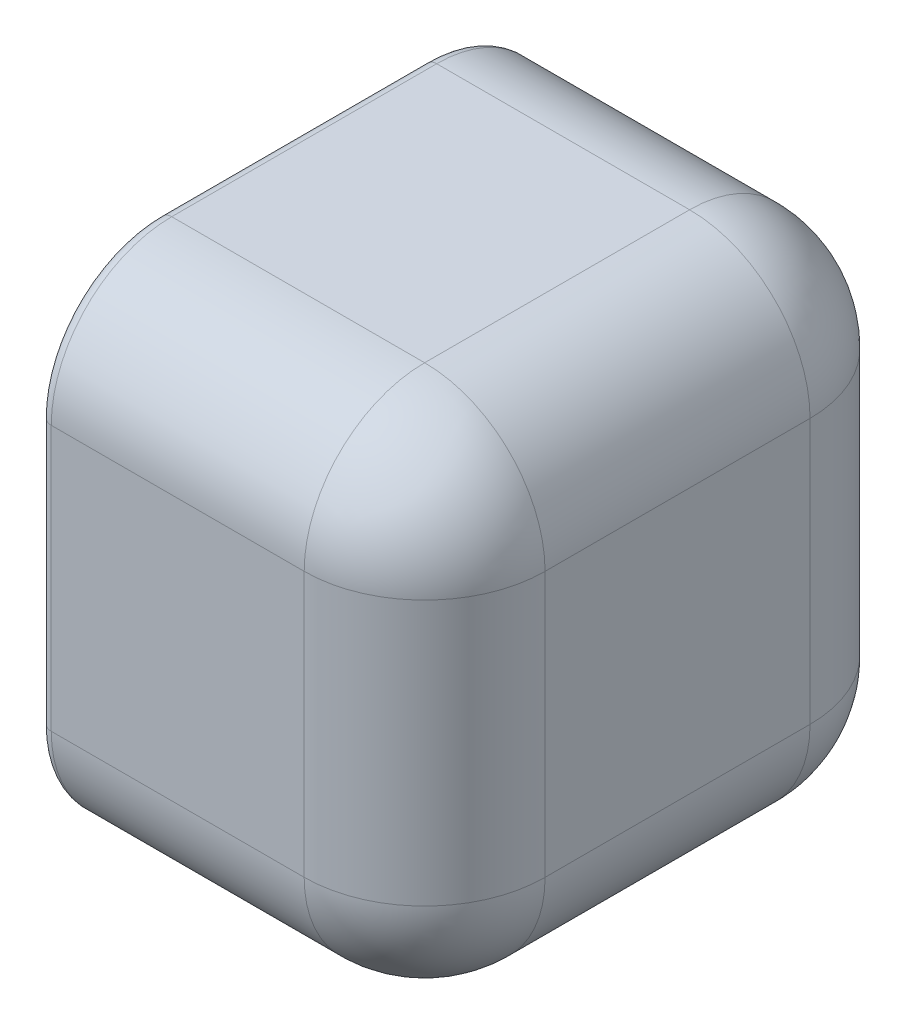
from build123d import *

# Parameters (mm, degrees)
ESQUISSE1_W             = 42
ESQUISSE1_H             = 42
BOSS_EXTRU_1_DEPTH      = 42
CONG_1_R                = 10
ESQUISSE10_W            = 10.140474199
ESQUISSE10_H            = 42
ENL_V_MAT_EXTRU_1_DEPTH = 64
ESQUISSE2_W             = 3.1
ESQUISSE2_H             = 14
ENL_V_MAT_EXTRU_5_DEPTH = 8
ESQUISSE14_W            = 30.142135624
ESQUISSE14_H            = 30.142135624
ENL_V_MAT_EXTRU_6_DEPTH = 22
ESQUISSE21_W            = 7
ESQUISSE21_H            = 7
BOSS_EXTRU_2_DEPTH      = 20
ESQUISSE24_R            = 1.675
ENL_V_MAT_EXTRU_8_DEPTH = 26
CONG_2_R                = 1
ESQUISSE27_R            = 2.375
ENL_V_MAT_EXTRU_9_DEPTH = 10


with BuildPart() as part:
    # Esquisse1 → Boss.-Extru.1 (new body)
    with BuildSketch(Plane.XY):
        Rectangle(ESQUISSE1_W, ESQUISSE1_H)
    extrude(amount=BOSS_EXTRU_1_DEPTH)

    # Congé1
    cong_1_edges = [part.edges().sort_by_distance(p)[0] for p in [
        (-21, 0, 42),
        (0, -21, 42),
        (21, 0, 42),
        (0, -21, 0),
        (-21, 0, 0),
        (0, 21, 0),
        (21, 0, 0),
        (21, -21, 21),
        (-21, -21, 21),
        (-21, 21, 21),
        (21, 21, 21),
        (0, 21, 42),
    ]]
    fillet(cong_1_edges, radius=CONG_1_R)

    # Esquisse10 → Enlèv. mat.-Extru.1 (cut, through all)
    with BuildSketch(Plane(origin=(0, -21, 0), x_dir=(-1, 0, 0), z_dir=(0, -1, 0))):
        with Locations((16.070237099, -21)):
            Rectangle(ESQUISSE10_W, ESQUISSE10_H)
    extrude(amount=-ENL_V_MAT_EXTRU_1_DEPTH, mode=Mode.SUBTRACT)

    # Esquisse2 → Enlèv. mat.-Extru.5 (cut)
    with BuildSketch(Plane(origin=(0, 0, 0), x_dir=(-1, 0, 0), z_dir=(0, 0, -1))):
        Rectangle(ESQUISSE2_W, ESQUISSE2_H)
    extrude(amount=-ENL_V_MAT_EXTRU_5_DEPTH, mode=Mode.SUBTRACT)

    # Esquisse14 → Enlèv. mat.-Extru.6 (cut)
    with BuildSketch(Plane.ZY.offset(11)):
        with Locations((21, 0)):
            Rectangle(ESQUISSE14_W, ESQUISSE14_H)
    extrude(amount=-ENL_V_MAT_EXTRU_6_DEPTH, mode=Mode.SUBTRACT)

    # Esquisse21 → Boss.-Extru.2 (add)
    with BuildSketch(Plane.ZY.offset(-11)):
        with Locations((32.571067812, -11.571067812)):
            Rectangle(ESQUISSE21_W, ESQUISSE21_H)
        with Locations((32.571067812, 11.571067812)):
            Rectangle(ESQUISSE21_W, ESQUISSE21_H)
    extrude(amount=BOSS_EXTRU_2_DEPTH)

    # Esquisse24 → Enlèv. mat.-Extru.8 (cut)
    with BuildSketch(Plane.ZY.offset(-11)):
        with Locations(Location((32.071067812, 11.571067812, 0), (0, 0, 180))):
            Circle(ESQUISSE24_R)
        with Locations(Location((32.071067812, -11.571067812, 0), (0, 0, 180))):
            Circle(ESQUISSE24_R)
    extrude(amount=ENL_V_MAT_EXTRU_8_DEPTH, mode=Mode.SUBTRACT)

    # Congé2
    cong_2_edges = [part.edges().sort_by_distance(p)[0] for p in [
        (11, -15.071067812, 17.5),
        (-11, 0, 5.928932188),
        (-11, -15.071067812, 21),
        (-11, 0, 36.071067812),
        (-11, 15.071067812, 21),
        (11, 0, 36.071067812),
        (-10, -15.071067812, 36.071067812),
        (11, -8.071067812, 32.571067812),
        (1, -8.071067812, 36.071067812),
        (11, -11.571067812, 29.071067812),
        (1, -8.071067812, 29.071067812),
        (1, -15.071067812, 29.071067812),
        (-9, -11.571067812, 36.071067812),
        (-9, -8.071067812, 32.571067812),
        (-9, -11.571067812, 29.071067812),
        (-9, -15.071067812, 32.571067812),
        (11, 15.071067812, 17.5),
        (-10, 15.071067812, 36.071067812),
        (1, 8.071067812, 36.071067812),
        (11, 11.571067812, 29.071067812),
        (1, 15.071067812, 29.071067812),
        (11, 8.071067812, 32.571067812),
        (1, 8.071067812, 29.071067812),
        (-9, 11.571067812, 36.071067812),
        (-9, 15.071067812, 32.571067812),
        (-9, 11.571067812, 29.071067812),
        (-9, 8.071067812, 32.571067812),
        (-11, -21, 21),
        (-11, 0, 0),
        (-11, 21, 21),
        (-11, 0, 42),
        (-11, 18.071067812, 39.071067812),
        (-11, 18.071067812, 2.928932188),
        (-11, -18.071067812, 39.071067812),
        (-11, -18.071067812, 2.928932188),
        (0, -7, 0),
        (1.55, 0, 0),
        (0, 7, 0),
        (-1.55, 0, 0),
        (1.55, 0, 5.928932188),
        (11, 0, 5.928932188),
        (0, -15.071067812, 5.928932188),
        (0, 7, 5.928932188),
        (-1.55, 0, 5.928932188),
        (0, -7, 5.928932188),
        (0, 15.071067812, 5.928932188),
    ]]
    fillet(cong_2_edges, radius=CONG_2_R - 0.0001)  # a hair under: the kernel refuses the full size

    # Esquisse27 → Enlèv. mat.-Extru.9 (cut)
    with BuildSketch(Plane(origin=(0, 0, 0), x_dir=(-1, 0, 0), z_dir=(0, 0, -1))):
        with BuildLine():
            ThreePointArc((5.125, 7.5), (5.820621395, 5.820621395), (7.5, 5.125))
            Line((7.5, 5.125), (7.5, 7.5))
            Line((7.5, 7.5), (5.125, 7.5))
        make_face()
        with BuildLine():
            Line((7.5, 7.5), (7.5, 5.125))
            ThreePointArc((7.5, 5.125), (9.179378605, 5.820621395), (9.875, 7.5))
            ThreePointArc((9.875, 7.5), (7.5, 9.875), (5.125, 7.5))
            Line((5.125, 7.5), (7.5, 7.5))
        make_face()
        with BuildLine():
            ThreePointArc((-5.125, 7.5), (-9.179378605, 9.179378605), (-7.5, 5.125))
            Line((-7.5, 5.125), (-7.5, 7.5))
            Line((-7.5, 7.5), (-5.125, 7.5))
        make_face()
        with BuildLine():
            Line((-7.5, 7.5), (-7.5, 5.125))
            ThreePointArc((-7.5, 5.125), (-5.820621395, 5.820621395), (-5.125, 7.5))
            Line((-5.125, 7.5), (-7.5, 7.5))
        make_face()
        with BuildLine():
            Line((-7.5, -5.125), (-7.5, -7.5))
            Line((-7.5, -7.5), (-5.125, -7.5))
            ThreePointArc((-5.125, -7.5), (-5.820621395, -5.820621395), (-7.5, -5.125))
        make_face()
        with BuildLine():
            Line((-5.125, -7.5), (-7.5, -7.5))
            Line((-7.5, -7.5), (-7.5, -5.125))
            ThreePointArc((-7.5, -5.125), (-9.179378605, -9.179378605), (-5.125, -7.5))
        make_face()
        with Locations((7.5, -7.5)):
            Circle(ESQUISSE27_R)
    extrude(amount=-ENL_V_MAT_EXTRU_9_DEPTH, mode=Mode.SUBTRACT)


solid = part.part
